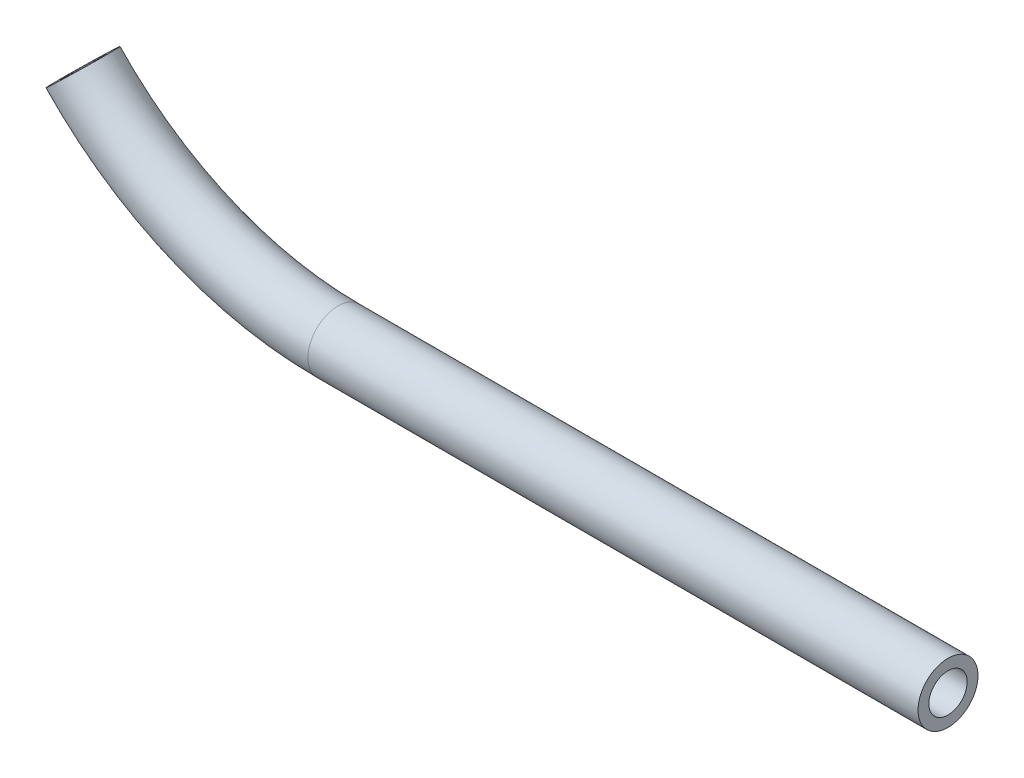
from build123d import *

# Parameters (mm, degrees)
SKETCH5_R           = 0.61
SKETCH5_R_2         = 0.39
SKETCH5_2_R         = 0.61
SKETCH5_2_R_2       = 0.39
BOSS_EXTRUDE2_DEPTH = 10


with BuildPart() as part:
    # Sweep2: sweep along a path in Sketch4
    with BuildLine(Plane.XY) as sweep2_path:
        Line((-65.954222951, 0), (-68.364968213, 0))
        ThreePointArc((-68.364968213, 0), (-71.186123393, 0.579815367), (-73.549932813, 2.225265895))
    # Sketch5 → Sweep2 (sweep)
    with BuildSketch(Plane(origin=(-65.954222951, 0, 0), x_dir=(0, 0, -1), z_dir=(1, 0, 0))):
        Circle(SKETCH5_R)
        Circle(SKETCH5_R_2, mode=Mode.SUBTRACT)
    sweep(path=sweep2_path.line)

    # Sketch5<2> → Boss-Extrude2 (add)
    with BuildSketch(Plane(origin=(-65.954222951, 0, 0), x_dir=(0, 0, -1), z_dir=(1, 0, 0))):
        Circle(SKETCH5_2_R)
        Circle(SKETCH5_2_R_2, mode=Mode.SUBTRACT)
    extrude(amount=BOSS_EXTRUDE2_DEPTH)


solid = part.part
